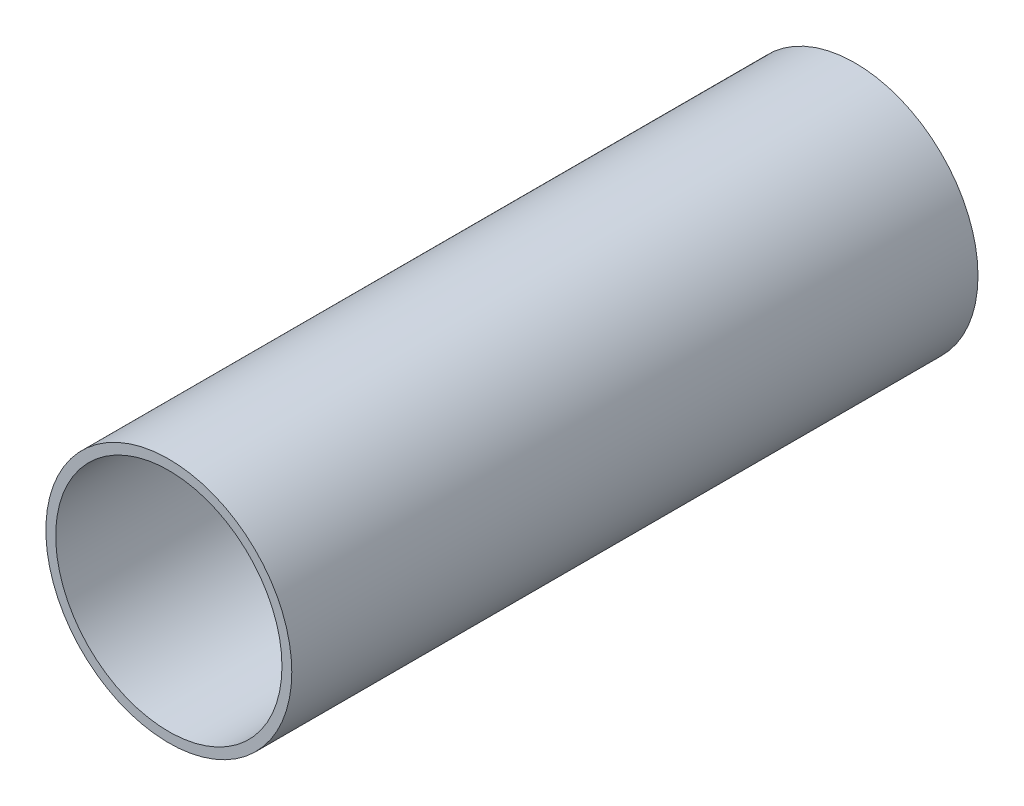
from build123d import *

# Parameters (mm, degrees)
BOSS_EXTRUDE1_DEPTH      = 39.5
BOSS_EXTRUDE1_DEPTH_BACK = 100
SKETCH1_R                = 25
SKETCH1_R_2              = 23


with BuildPart() as part:
    # Sketch1 → Boss-Extrude1 (new, two sides: drawn at the far end of the back side and taken through both)
    with BuildSketch(Plane.XY.offset(-BOSS_EXTRUDE1_DEPTH_BACK)):
        Circle(SKETCH1_R)
        Circle(SKETCH1_R_2, mode=Mode.SUBTRACT)
    extrude(amount=BOSS_EXTRUDE1_DEPTH + BOSS_EXTRUDE1_DEPTH_BACK)


solid = part.part
